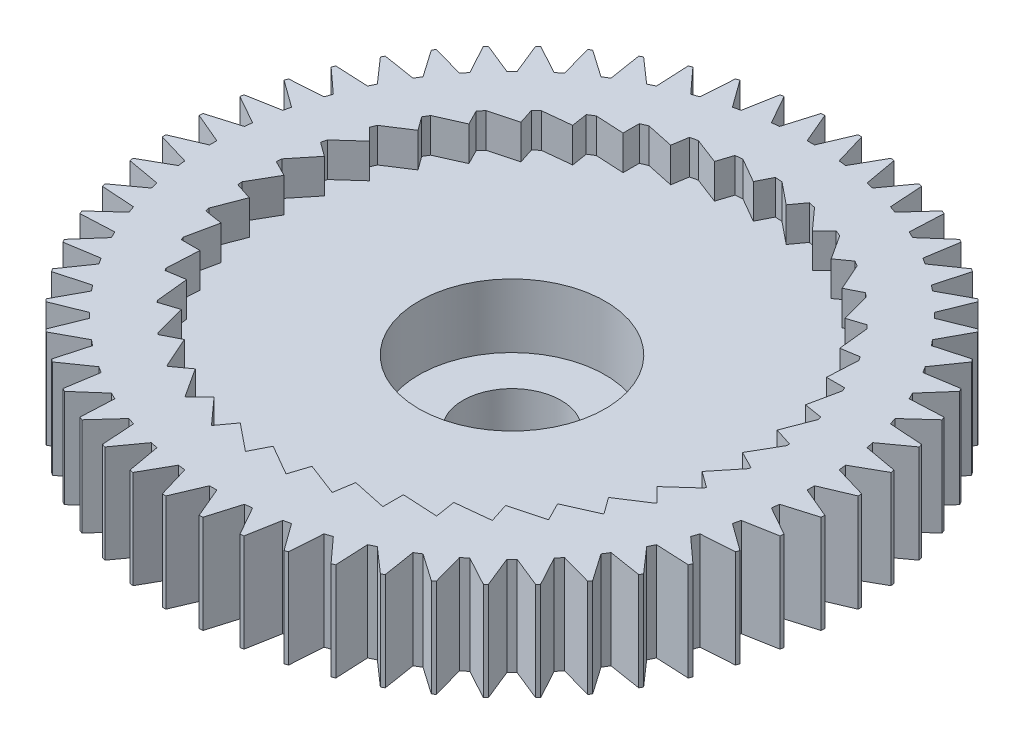
from build123d import *

# Parameters (mm, degrees)
BOSS_EXTRUDE1_DEPTH = 2
CUT_EXTRUDE1_DEPTH  = 0.7
SKETCH3_R           = 2.4
BOSS_EXTRUDE2_DEPTH = 0.75
SKETCH4_R           = 1.75
BOSS_EXTRUDE3_DEPTH = 1
SKETCH5_R           = 1.9
CUT_EXTRUDE2_DEPTH  = 1.3
SKETCH6_R           = 1
CUT_EXTRUDE3_DEPTH  = 2


# Read off the part's stored shape, not the designer's step: Boss-Extrude1
with BuildPart() as part:
    # Boss-Extrude1 outline → Boss-Extrude1 (new body)
    with BuildSketch(Plane(origin=(0, 0, 0), x_dir=(1, 0, 0), z_dir=(0, 1, 0))):
        with BuildLine():
            Line((0.340379237, 6.716380497), (0.075, 6.091186192))
            Line((0.075, 6.091186192), (-0.075, 6.091186192))
            Line((-0.075, 6.091186192), (-0.340379237, 6.716380497))
            ThreePointArc((-0.340379237, 6.716380497), (-0.377073757, 6.714420331), (-0.413757019, 6.712259689))
            Line((-0.413757019, 6.712259689), (-0.607468055, 6.061283428))
            Line((-0.607468055, 6.061283428), (-0.756524887, 6.044488756))
            Line((-0.756524887, 6.044488756), (-1.090235028, 6.636038923))
            ThreePointArc((-1.090235028, 6.636038923), (-1.126479352, 6.6299826), (-1.162690042, 6.623728321))
            Line((-1.162690042, 6.623728321), (-1.282296847, 5.955156507))
            Line((-1.282296847, 5.955156507), (-1.428536034, 5.921778367))
            Line((-1.428536034, 5.921778367), (-1.82638048, 6.472245309))
            ThreePointArc((-1.82638048, 6.472245309), (-1.861718814, 6.46216899), (-1.897001562, 6.451899726))
            Line((-1.897001562, 6.451899726), (-1.941000012, 5.774140038))
            Line((-1.941000012, 5.774140038), (-2.082582511, 5.724598179))
            Line((-2.082582511, 5.724598179), (-2.539558138, 6.227059455))
            ThreePointArc((-2.539558138, 6.227059455), (-2.573546083, 6.213089856), (-2.607457187, 6.198934749))
            Line((-2.607457187, 6.198934749), (-2.575293976, 5.520510408))
            Line((-2.575293976, 5.520510408), (-2.710439306, 5.455427847))
            Line((-2.710439306, 5.455427847), (-3.220799379, 5.903564716))
            ThreePointArc((-3.220799379, 5.903564716), (-3.253009516, 5.885877512), (-3.285122525, 5.86801457))
            Line((-3.285122525, 5.86801457), (-3.177202123, 5.197457157))
            Line((-3.177202123, 5.197457157), (-3.304210753, 5.117652345))
            Line((-3.304210753, 5.117652345), (-3.8615372, 5.505829225))
            ThreePointArc((-3.8615372, 5.505829225), (-3.891564467, 5.484646844), (-3.921475541, 5.463300704))
            Line((-3.921475541, 5.463300704), (-3.739155111, 4.809042866))
            Line((-3.739155111, 4.809042866), (-3.856429833, 4.715519395))
            Line((-3.856429833, 4.715519395), (-4.453713949, 5.038854737))
            ThreePointArc((-4.453713949, 5.038854737), (-4.481180737, 5.014443559), (-4.508513727, 4.989882661))
            Line((-4.508513727, 4.989882661), (-4.254086053, 4.36015207))
            Line((-4.254086053, 4.36015207), (-4.36015207, 4.254086053))
            Line((-4.36015207, 4.254086053), (-4.989882661, 4.508513727))
            ThreePointArc((-4.989882661, 4.508513727), (-5.014443559, 4.481180737), (-5.038854737, 4.453713949))
            Line((-5.038854737, 4.453713949), (-4.715519395, 3.856429833))
            Line((-4.715519395, 3.856429833), (-4.809042866, 3.739155111))
            Line((-4.809042866, 3.739155111), (-5.463300704, 3.921475541))
            ThreePointArc((-5.463300704, 3.921475541), (-5.484646844, 3.891564467), (-5.505829225, 3.8615372))
            Line((-5.505829225, 3.8615372), (-5.117652345, 3.304210753))
            Line((-5.117652345, 3.304210753), (-5.197457157, 3.177202123))
            Line((-5.197457157, 3.177202123), (-5.86801457, 3.285122525))
            ThreePointArc((-5.86801457, 3.285122525), (-5.885877512, 3.253009516), (-5.903564716, 3.220799379))
            Line((-5.903564716, 3.220799379), (-5.455427847, 2.710439306))
            Line((-5.455427847, 2.710439306), (-5.520510408, 2.575293976))
            Line((-5.520510408, 2.575293976), (-6.198934749, 2.607457187))
            ThreePointArc((-6.198934749, 2.607457187), (-6.213089856, 2.573546083), (-6.227059455, 2.539558138))
            Line((-6.227059455, 2.539558138), (-5.724598179, 2.082582511))
            Line((-5.724598179, 2.082582511), (-5.774140038, 1.941000012))
            Line((-5.774140038, 1.941000012), (-6.451899726, 1.897001562))
            ThreePointArc((-6.451899726, 1.897001562), (-6.46216899, 1.861718814), (-6.472245309, 1.82638048))
            Line((-6.472245309, 1.82638048), (-5.921778367, 1.428536034))
            Line((-5.921778367, 1.428536034), (-5.955156507, 1.282296847))
            Line((-5.955156507, 1.282296847), (-6.623728321, 1.162690042))
            ThreePointArc((-6.623728321, 1.162690042), (-6.6299826, 1.126479352), (-6.636038923, 1.090235028))
            Line((-6.636038923, 1.090235028), (-6.044488756, 0.756524887))
            Line((-6.044488756, 0.756524887), (-6.061283428, 0.607468055))
            Line((-6.061283428, 0.607468055), (-6.712259689, 0.413757019))
            ThreePointArc((-6.712259689, 0.413757019), (-6.714420331, 0.377073757), (-6.716380497, 0.340379237))
            Line((-6.716380497, 0.340379237), (-6.091186192, 0.075))
            Line((-6.091186192, 0.075), (-6.091186192, -0.075))
            Line((-6.091186192, -0.075), (-6.716380497, -0.340379237))
            ThreePointArc((-6.716380497, -0.340379237), (-6.714420331, -0.377073757), (-6.712259689, -0.413757019))
            Line((-6.712259689, -0.413757019), (-6.061283428, -0.607468055))
            Line((-6.061283428, -0.607468055), (-6.044488756, -0.756524887))
            Line((-6.044488756, -0.756524887), (-6.636038923, -1.090235028))
            ThreePointArc((-6.636038923, -1.090235028), (-6.6299826, -1.126479352), (-6.623728321, -1.162690042))
            Line((-6.623728321, -1.162690042), (-5.955156507, -1.282296847))
            Line((-5.955156507, -1.282296847), (-5.921778367, -1.428536034))
            Line((-5.921778367, -1.428536034), (-6.472245309, -1.82638048))
            ThreePointArc((-6.472245309, -1.82638048), (-6.46216899, -1.861718814), (-6.451899726, -1.897001562))
            Line((-6.451899726, -1.897001562), (-5.774140038, -1.941000012))
            Line((-5.774140038, -1.941000012), (-5.724598179, -2.082582511))
            Line((-5.724598179, -2.082582511), (-6.227059455, -2.539558138))
            ThreePointArc((-6.227059455, -2.539558138), (-6.213089856, -2.573546083), (-6.198934749, -2.607457187))
            Line((-6.198934749, -2.607457187), (-5.520510408, -2.575293976))
            Line((-5.520510408, -2.575293976), (-5.455427847, -2.710439306))
            Line((-5.455427847, -2.710439306), (-5.903564716, -3.220799379))
            ThreePointArc((-5.903564716, -3.220799379), (-5.885877512, -3.253009516), (-5.86801457, -3.285122525))
            Line((-5.86801457, -3.285122525), (-5.197457157, -3.177202123))
            Line((-5.197457157, -3.177202123), (-5.117652345, -3.304210753))
            Line((-5.117652345, -3.304210753), (-5.505829225, -3.8615372))
            ThreePointArc((-5.505829225, -3.8615372), (-5.484646844, -3.891564467), (-5.463300704, -3.921475541))
            Line((-5.463300704, -3.921475541), (-4.809042866, -3.739155111))
            Line((-4.809042866, -3.739155111), (-4.715519395, -3.856429833))
            Line((-4.715519395, -3.856429833), (-5.038854737, -4.453713949))
            ThreePointArc((-5.038854737, -4.453713949), (-5.014443559, -4.481180737), (-4.989882661, -4.508513727))
            Line((-4.989882661, -4.508513727), (-4.36015207, -4.254086053))
            Line((-4.36015207, -4.254086053), (-4.254086053, -4.36015207))
            Line((-4.254086053, -4.36015207), (-4.508513727, -4.989882661))
            ThreePointArc((-4.508513727, -4.989882661), (-4.481180737, -5.014443559), (-4.453713949, -5.038854737))
            Line((-4.453713949, -5.038854737), (-3.856429833, -4.715519395))
            Line((-3.856429833, -4.715519395), (-3.739155111, -4.809042866))
            Line((-3.739155111, -4.809042866), (-3.921475541, -5.463300704))
            ThreePointArc((-3.921475541, -5.463300704), (-3.891564467, -5.484646844), (-3.8615372, -5.505829225))
            Line((-3.8615372, -5.505829225), (-3.304210753, -5.117652345))
            Line((-3.304210753, -5.117652345), (-3.177202123, -5.197457157))
            Line((-3.177202123, -5.197457157), (-3.285122525, -5.86801457))
            ThreePointArc((-3.285122525, -5.86801457), (-3.253009516, -5.885877512), (-3.220799379, -5.903564716))
            Line((-3.220799379, -5.903564716), (-2.710439306, -5.455427847))
            Line((-2.710439306, -5.455427847), (-2.575293976, -5.520510408))
            Line((-2.575293976, -5.520510408), (-2.607457187, -6.198934749))
            ThreePointArc((-2.607457187, -6.198934749), (-2.573546083, -6.213089856), (-2.539558138, -6.227059455))
            Line((-2.539558138, -6.227059455), (-2.082582511, -5.724598179))
            Line((-2.082582511, -5.724598179), (-1.941000012, -5.774140038))
            Line((-1.941000012, -5.774140038), (-1.897001562, -6.451899726))
            ThreePointArc((-1.897001562, -6.451899726), (-1.861718814, -6.46216899), (-1.82638048, -6.472245309))
            Line((-1.82638048, -6.472245309), (-1.428536034, -5.921778367))
            Line((-1.428536034, -5.921778367), (-1.282296847, -5.955156507))
            Line((-1.282296847, -5.955156507), (-1.162690042, -6.623728321))
            ThreePointArc((-1.162690042, -6.623728321), (-1.126479352, -6.6299826), (-1.090235028, -6.636038923))
            Line((-1.090235028, -6.636038923), (-0.756524887, -6.044488756))
            Line((-0.756524887, -6.044488756), (-0.607468055, -6.061283428))
            Line((-0.607468055, -6.061283428), (-0.413757019, -6.712259689))
            ThreePointArc((-0.413757019, -6.712259689), (-0.377073757, -6.714420331), (-0.340379237, -6.716380497))
            Line((-0.340379237, -6.716380497), (-0.075, -6.091186192))
            Line((-0.075, -6.091186192), (0.075, -6.091186192))
            Line((0.075, -6.091186192), (0.340379237, -6.716380497))
            ThreePointArc((0.340379237, -6.716380497), (0.377073757, -6.714420331), (0.413757019, -6.712259689))
            Line((0.413757019, -6.712259689), (0.607468055, -6.061283428))
            Line((0.607468055, -6.061283428), (0.756524887, -6.044488756))
            Line((0.756524887, -6.044488756), (1.090235028, -6.636038923))
            ThreePointArc((1.090235028, -6.636038923), (1.126479352, -6.6299826), (1.162690042, -6.623728321))
            Line((1.162690042, -6.623728321), (1.282296847, -5.955156507))
            Line((1.282296847, -5.955156507), (1.428536034, -5.921778367))
            Line((1.428536034, -5.921778367), (1.82638048, -6.472245309))
            ThreePointArc((1.82638048, -6.472245309), (1.861718814, -6.46216899), (1.897001562, -6.451899726))
            Line((1.897001562, -6.451899726), (1.941000012, -5.774140038))
            Line((1.941000012, -5.774140038), (2.082582511, -5.724598179))
            Line((2.082582511, -5.724598179), (2.539558138, -6.227059455))
            ThreePointArc((2.539558138, -6.227059455), (2.573546083, -6.213089856), (2.607457187, -6.198934749))
            Line((2.607457187, -6.198934749), (2.575293976, -5.520510408))
            Line((2.575293976, -5.520510408), (2.710439306, -5.455427847))
            Line((2.710439306, -5.455427847), (3.220799379, -5.903564716))
            ThreePointArc((3.220799379, -5.903564716), (3.253009516, -5.885877512), (3.285122525, -5.86801457))
            Line((3.285122525, -5.86801457), (3.177202123, -5.197457157))
            Line((3.177202123, -5.197457157), (3.304210753, -5.117652345))
            Line((3.304210753, -5.117652345), (3.8615372, -5.505829225))
            ThreePointArc((3.8615372, -5.505829225), (3.891564467, -5.484646844), (3.921475541, -5.463300704))
            Line((3.921475541, -5.463300704), (3.739155111, -4.809042866))
            Line((3.739155111, -4.809042866), (3.856429833, -4.715519395))
            Line((3.856429833, -4.715519395), (4.453713949, -5.038854737))
            ThreePointArc((4.453713949, -5.038854737), (4.481180737, -5.014443559), (4.508513727, -4.989882661))
            Line((4.508513727, -4.989882661), (4.254086053, -4.36015207))
            Line((4.254086053, -4.36015207), (4.36015207, -4.254086053))
            Line((4.36015207, -4.254086053), (4.989882661, -4.508513727))
            ThreePointArc((4.989882661, -4.508513727), (5.014443559, -4.481180737), (5.038854737, -4.453713949))
            Line((5.038854737, -4.453713949), (4.715519395, -3.856429833))
            Line((4.715519395, -3.856429833), (4.809042866, -3.739155111))
            Line((4.809042866, -3.739155111), (5.463300704, -3.921475541))
            ThreePointArc((5.463300704, -3.921475541), (5.484646844, -3.891564467), (5.505829225, -3.8615372))
            Line((5.505829225, -3.8615372), (5.117652345, -3.304210753))
            Line((5.117652345, -3.304210753), (5.197457157, -3.177202123))
            Line((5.197457157, -3.177202123), (5.86801457, -3.285122525))
            ThreePointArc((5.86801457, -3.285122525), (5.885877512, -3.253009516), (5.903564716, -3.220799379))
            Line((5.903564716, -3.220799379), (5.455427847, -2.710439306))
            Line((5.455427847, -2.710439306), (5.520510408, -2.575293976))
            Line((5.520510408, -2.575293976), (6.198934749, -2.607457187))
            ThreePointArc((6.198934749, -2.607457187), (6.213089856, -2.573546083), (6.227059455, -2.539558138))
            Line((6.227059455, -2.539558138), (5.724598179, -2.082582511))
            Line((5.724598179, -2.082582511), (5.774140038, -1.941000012))
            Line((5.774140038, -1.941000012), (6.451899726, -1.897001562))
            ThreePointArc((6.451899726, -1.897001562), (6.46216899, -1.861718814), (6.472245309, -1.82638048))
            Line((6.472245309, -1.82638048), (5.921778367, -1.428536034))
            Line((5.921778367, -1.428536034), (5.955156507, -1.282296847))
            Line((5.955156507, -1.282296847), (6.623728321, -1.162690042))
            ThreePointArc((6.623728321, -1.162690042), (6.6299826, -1.126479352), (6.636038923, -1.090235028))
            Line((6.636038923, -1.090235028), (6.044488756, -0.756524887))
            Line((6.044488756, -0.756524887), (6.061283428, -0.607468055))
            Line((6.061283428, -0.607468055), (6.712259689, -0.413757019))
            ThreePointArc((6.712259689, -0.413757019), (6.714420331, -0.377073757), (6.716380497, -0.340379237))
            Line((6.716380497, -0.340379237), (6.091186192, -0.075))
            Line((6.091186192, -0.075), (6.091186192, 0.075))
            Line((6.091186192, 0.075), (6.716380497, 0.340379237))
            ThreePointArc((6.716380497, 0.340379237), (6.714420331, 0.377073757), (6.712259689, 0.413757019))
            Line((6.712259689, 0.413757019), (6.061283428, 0.607468055))
            Line((6.061283428, 0.607468055), (6.044488756, 0.756524887))
            Line((6.044488756, 0.756524887), (6.636038923, 1.090235028))
            ThreePointArc((6.636038923, 1.090235028), (6.6299826, 1.126479352), (6.623728321, 1.162690042))
            Line((6.623728321, 1.162690042), (5.955156507, 1.282296847))
            Line((5.955156507, 1.282296847), (5.921778367, 1.428536034))
            Line((5.921778367, 1.428536034), (6.472245309, 1.82638048))
            ThreePointArc((6.472245309, 1.82638048), (6.46216899, 1.861718814), (6.451899726, 1.897001562))
            Line((6.451899726, 1.897001562), (5.774140038, 1.941000012))
            Line((5.774140038, 1.941000012), (5.724598179, 2.082582511))
            Line((5.724598179, 2.082582511), (6.227059455, 2.539558138))
            ThreePointArc((6.227059455, 2.539558138), (6.213089856, 2.573546083), (6.198934749, 2.607457187))
            Line((6.198934749, 2.607457187), (5.520510408, 2.575293976))
            Line((5.520510408, 2.575293976), (5.455427847, 2.710439306))
            Line((5.455427847, 2.710439306), (5.903564716, 3.220799379))
            ThreePointArc((5.903564716, 3.220799379), (5.885877512, 3.253009516), (5.86801457, 3.285122525))
            Line((5.86801457, 3.285122525), (5.197457157, 3.177202123))
            Line((5.197457157, 3.177202123), (5.117652345, 3.304210753))
            Line((5.117652345, 3.304210753), (5.505829225, 3.8615372))
            ThreePointArc((5.505829225, 3.8615372), (5.484646844, 3.891564467), (5.463300704, 3.921475541))
            Line((5.463300704, 3.921475541), (4.809042866, 3.739155111))
            Line((4.809042866, 3.739155111), (4.715519395, 3.856429833))
            Line((4.715519395, 3.856429833), (5.038854737, 4.453713949))
            ThreePointArc((5.038854737, 4.453713949), (5.014443559, 4.481180737), (4.989882661, 4.508513727))
            Line((4.989882661, 4.508513727), (4.36015207, 4.254086053))
            Line((4.36015207, 4.254086053), (4.254086053, 4.36015207))
            Line((4.254086053, 4.36015207), (4.508513727, 4.989882661))
            ThreePointArc((4.508513727, 4.989882661), (4.481180737, 5.014443559), (4.453713949, 5.038854737))
            Line((4.453713949, 5.038854737), (3.856429833, 4.715519395))
            Line((3.856429833, 4.715519395), (3.739155111, 4.809042866))
            Line((3.739155111, 4.809042866), (3.921475541, 5.463300704))
            ThreePointArc((3.921475541, 5.463300704), (3.891564467, 5.484646844), (3.8615372, 5.505829225))
            Line((3.8615372, 5.505829225), (3.304210753, 5.117652345))
            Line((3.304210753, 5.117652345), (3.177202123, 5.197457157))
            Line((3.177202123, 5.197457157), (3.285122525, 5.86801457))
            ThreePointArc((3.285122525, 5.86801457), (3.253009516, 5.885877512), (3.220799379, 5.903564716))
            Line((3.220799379, 5.903564716), (2.710439306, 5.455427847))
            Line((2.710439306, 5.455427847), (2.575293976, 5.520510408))
            Line((2.575293976, 5.520510408), (2.607457187, 6.198934749))
            ThreePointArc((2.607457187, 6.198934749), (2.573546083, 6.213089856), (2.539558138, 6.227059455))
            Line((2.539558138, 6.227059455), (2.082582511, 5.724598179))
            Line((2.082582511, 5.724598179), (1.941000012, 5.774140038))
            Line((1.941000012, 5.774140038), (1.897001562, 6.451899726))
            ThreePointArc((1.897001562, 6.451899726), (1.861718814, 6.46216899), (1.82638048, 6.472245309))
            Line((1.82638048, 6.472245309), (1.428536034, 5.921778367))
            Line((1.428536034, 5.921778367), (1.282296847, 5.955156507))
            Line((1.282296847, 5.955156507), (1.162690042, 6.623728321))
            ThreePointArc((1.162690042, 6.623728321), (1.126479352, 6.6299826), (1.090235028, 6.636038923))
            Line((1.090235028, 6.636038923), (0.756524887, 6.044488756))
            Line((0.756524887, 6.044488756), (0.607468055, 6.061283428))
            Line((0.607468055, 6.061283428), (0.413757019, 6.712259689))
            ThreePointArc((0.413757019, 6.712259689), (0.377073757, 6.714420331), (0.340379237, 6.716380497))
        make_face()
    extrude(amount=BOSS_EXTRUDE1_DEPTH)

    # Sketch2 → Cut-Extrude1 (cut)
    with BuildSketch(Plane(origin=(0, 2, 0), x_dir=(1, 0, 0), z_dir=(0, 1, 0))):
        with BuildLine():
            Line((1.359605577, -4.544146574), (2.059605577, -4.692936167))
            Line((2.059605577, -4.692936167), (2.059605577, -4.272936167))
            Line((2.059605577, -4.272936167), (2.772534225, -4.310299174))
            ThreePointArc((2.772534225, -4.310299174), (2.773312304, -4.309798588), (2.774090292, -4.309297861))
            Line((2.774090292, -4.309297861), (2.708560761, -3.895560685))
            Line((2.708560761, -3.895560685), (3.415163067, -3.82129379))
            ThreePointArc((3.415163067, -3.82129379), (3.417213017, -3.819460721), (3.419261983, -3.817626552))
            Line((3.419261983, -3.817626552), (3.290491697, -3.421312364))
            Line((3.290491697, -3.421312364), (3.971942884, -3.238718069))
            ThreePointArc((3.971942884, -3.238718069), (3.975370436, -3.234509993), (3.978793531, -3.230298289))
            Line((3.978793531, -3.230298289), (3.791069316, -2.861868772))
            Line((3.791069316, -2.861868772), (4.429656023, -2.577551652))
            ThreePointArc((4.429656023, -2.577551652), (4.434120542, -2.569863813), (4.438571719, -2.562168241))
            Line((4.438571719, -2.562168241), (4.197967735, -2.231005267))
            Line((4.197967735, -2.231005267), (4.777693444, -1.85452699))
            ThreePointArc((4.777693444, -1.85452699), (4.78240129, -1.842352546), (4.787078113, -1.830166152))
            Line((4.787078113, -1.830166152), (4.501167764, -1.544255803))
            Line((4.501167764, -1.544255803), (5.008251971, -1.087675131))
            ThreePointArc((5.008251971, -1.087675131), (5.012002421, -1.070260124), (5.015692314, -1.052832186))
            Line((5.015692314, -1.052832186), (4.693203612, -0.818530429))
            Line((4.693203612, -0.818530429), (5.116452999, -0.295860965))
            ThreePointArc((5.116452999, -0.295860965), (5.117732356, -0.272837915), (5.118908115, -0.249809341))
            Line((5.118908115, -0.249809341), (4.76934672, -0.071698914))
            Line((4.76934672, -0.071698914), (5.100386578, 0.501678939))
            ThreePointArc((5.100386578, 0.501678939), (5.097501413, 0.530192739), (5.094456843, 0.55868996))
            Line((5.094456843, 0.55868996), (4.727722191, 0.677849272))
            Line((4.727722191, 0.677849272), (4.961086803, 1.28578487))
            ThreePointArc((4.961086803, 1.28578487), (4.952323539, 1.319134779), (4.943336089, 1.352424973))
            Line((4.943336089, 1.352424973), (4.56935496, 1.411657765))
            Line((4.56935496, 1.411657765), (4.702445654, 2.037800252))
            ThreePointArc((4.702445654, 2.037800252), (4.686241268, 2.07479343), (4.669745869, 2.111657765))
            Line((4.669745869, 2.111657765), (4.298144553, 2.111657765))
            Line((4.298144553, 2.111657765), (4.331072967, 2.739969334))
            ThreePointArc((4.331072967, 2.739969334), (4.306180563, 2.778926764), (4.280937752, 2.817658064))
            Line((4.280937752, 2.817658064), (3.920769071, 2.760612949))
            Line((3.920769071, 2.760612949), (3.856110083, 3.375802131))
            ThreePointArc((3.856110083, 3.375802131), (3.821743536, 3.41465977), (3.786985442, 3.453167569))
            Line((3.786985442, 3.453167569), (3.44652075, 3.342543885))
            Line((3.44652075, 3.342543885), (3.289004047, 3.930404226))
            ThreePointArc((3.289004047, 3.930404226), (3.244947766, 3.966855051), (3.200487544, 4.002812072))
            Line((3.200487544, 4.002812072), (2.887077159, 3.843121504))
            Line((2.887077159, 3.843121504), (2.643248199, 4.390770315))
            ThreePointArc((2.643248199, 4.390770315), (2.58992109, 4.422435274), (2.536214702, 4.453452592))
            Line((2.536214702, 4.453452592), (2.256213654, 4.250019923))
            Line((2.256213654, 4.250019923), (1.934093707, 4.746041143))
            ThreePointArc((1.934093707, 4.746041143), (1.8725604, 4.77065431), (1.810713963, 4.794469725))
            Line((1.810713963, 4.794469725), (1.569464189, 4.553219952))
            Line((1.569464189, 4.553219952), (1.178235375, 4.987723569))
            ThreePointArc((1.178235375, 4.987723569), (1.110162346, 5.003315357), (1.041883181, 5.017978122))
            Line((1.041883181, 5.017978122), (0.843738816, 4.7452558))
            Line((0.843738816, 4.7452558), (0.393473929, 5.109873117))
            ThreePointArc((0.393473929, 5.109873117), (0.321032992, 5.11493527), (0.248527602, 5.118970505))
            Line((0.248527602, 5.118970505), (0.096907301, 4.821398908))
            Line((0.096907301, 4.821398908), (-0.401643683, 5.109237453))
            ThreePointArc((-0.401643683, 5.109237453), (-0.475917345, 5.102854856), (-0.550090312, 5.09539259))
            Line((-0.550090312, 5.09539259), (-0.652640885, 4.77977438))
            Line((-0.652640885, 4.77977438), (-1.188204626, 4.985358038))
            ThreePointArc((-1.188204626, 4.985358038), (-1.261588537, 4.967294975), (-1.334698115, 4.94815177))
            Line((-1.334698115, 4.94815177), (-1.386449379, 4.621407148))
            Line((-1.386449379, 4.621407148), (-1.947329315, 4.740625859))
            ThreePointArc((-1.947329315, 4.740625859), (-2.017109209, 4.711358131), (-2.086449379, 4.68106334))
            Line((-2.086449379, 4.68106334), (-2.086449379, 4.350196742))
            Line((-2.086449379, 4.350196742), (-2.660586343, 4.380285985))
            ThreePointArc((-2.660586343, 4.380285985), (-2.724254312, 4.340974942), (-2.787341558, 4.300738546))
            Line((-2.787341558, 4.300738546), (-2.735404562, 3.972821259))
            Line((-2.735404562, 3.972821259), (-3.310418339, 3.912384876))
            ThreePointArc((-3.310418339, 3.912384876), (-3.365856155, 3.864794606), (-3.420609899, 3.81641886))
            Line((-3.420609899, 3.81641886), (-3.317335499, 3.498572939))
            Line((-3.317335499, 3.498572939), (-3.88057158, 3.347654286))
            ThreePointArc((-3.88057158, 3.347654286), (-3.926202658, 3.294018471), (-3.971092463, 3.239760739))
            Line((-3.971092463, 3.239760739), (-3.817913118, 2.939129347))
            Line((-3.817913118, 2.939129347), (-4.356519529, 2.699326323))
            ThreePointArc((-4.356519529, 2.699326323), (-4.391415514, 2.642176146), (-4.425561829, 2.584574916))
            Line((-4.425561829, 2.584574916), (-4.224811536, 2.308265842))
            Line((-4.224811536, 2.308265842), (-4.725867932, 1.982876014))
            ThreePointArc((-4.725867932, 1.982876014), (-4.749799883, 1.924844428), (-4.773019262, 1.866524074))
            Line((-4.773019262, 1.866524074), (-4.528011565, 1.621516377))
            Line((-4.528011565, 1.621516377), (-4.978726918, 1.215690451))
            ThreePointArc((-4.978726918, 1.215690451), (-4.992156213, 1.159310719), (-5.004947078, 1.102782727))
            Line((-5.004947078, 1.102782727), (-4.720047414, 0.895791004))
            Line((-4.720047414, 0.895791004), (-5.108034204, 0.41666722))
            ThreePointArc((-5.108034204, 0.41666722), (-5.11204408, 0.364184468), (-5.115514733, 0.311663301))
            Line((-5.115514733, 0.311663301), (-4.796190522, 0.148959489))
            Line((-4.796190522, 0.148959489), (-5.109813223, -0.394250965))
            ThreePointArc((-5.109813223, -0.394250965), (-5.105987753, -0.441037486), (-5.101733905, -0.487787005))
            Line((-5.101733905, -0.487787005), (-4.754565993, -0.600588697))
            Line((-4.754565993, -0.600588697), (-4.983351035, -1.196594109))
            ThreePointArc((-4.983351035, -1.196594109), (-4.973613675, -1.23644329), (-4.963557668, -1.276213256))
            Line((-4.963557668, -1.276213256), (-4.596198762, -1.334397191))
            Line((-4.596198762, -1.334397191), (-4.731283251, -1.969919745))
            ThreePointArc((-4.731283251, -1.969919745), (-4.717711232, -2.002205217), (-4.703918906, -2.034397191))
            Line((-4.703918906, -2.034397191), (-4.324988355, -2.034397191))
            Line((-4.324988355, -2.034397191), (-4.359576888, -2.694385711))
            ThreePointArc((-4.359576888, -2.694385711), (-4.344210194, -2.719092273), (-4.328703485, -2.743711197))
            Line((-4.328703485, -2.743711197), (-3.947612873, -2.683352374))
            Line((-3.947612873, -2.683352374), (-3.877406701, -3.351319483))
            ThreePointArc((-3.877406701, -3.351319483), (-3.862070845, -3.36898112), (-3.846654541, -3.386572581))
            Line((-3.846654541, -3.386572581), (-3.473364552, -3.265283311))
            Line((-3.473364552, -3.265283311), (-3.296925826, -3.9237616))
            ThreePointArc((-3.296925826, -3.9237616), (-3.283086021, -3.935348928), (-3.269205491, -3.94688744))
            Line((-3.269205491, -3.94688744), (-2.91392096, -3.76586093))
            Line((-2.91392096, -3.76586093), (-2.632937026, -4.39696118))
            ThreePointArc((-2.632937026, -4.39696118), (-2.621597833, -4.40373135), (-2.610241233, -4.410472277))
            Line((-2.610241233, -4.410472277), (-2.283057456, -4.172759348))
            Line((-2.283057456, -4.172759348), (-1.902475973, -4.758803439))
            ThreePointArc((-1.902475973, -4.758803439), (-1.894135498, -4.762129326), (-1.885789208, -4.765440595))
            Line((-1.885789208, -4.765440595), (-1.596307991, -4.475959377))
            Line((-1.596307991, -4.475959377), (-1.124322479, -5.000152394))
            ThreePointArc((-1.124322479, -5.000152394), (-1.118984202, -5.001349753), (-1.11364465, -5.002541413))
            Line((-1.11364465, -5.002541413), (-0.870582618, -4.667995226))
            Line((-0.870582618, -4.667995226), (-0.318458922, -5.115096178))
            ThreePointArc((-0.318458922, -5.115096178), (-0.315698108, -5.115267315), (-0.312937203, -5.115436962))
            Line((-0.312937203, -5.115436962), (-0.123751102, -4.744138334))
            Line((-0.123751102, -4.744138334), (0.494502715, -5.101087341))
            ThreePointArc((0.494502715, -5.101087341), (0.495426875, -5.100997668), (0.496351019, -5.100907828))
            Line((0.496351019, -5.100907828), (0.625797084, -4.702513805))
            Line((0.625797084, -4.702513805), (1.293903102, -4.958975677))
            Line((1.293903102, -4.958975677), (1.359605577, -4.544146574))
        make_face()
    extrude(amount=-CUT_EXTRUDE1_DEPTH, mode=Mode.SUBTRACT)

    # Sketch3 → Boss-Extrude2 (add)
    with BuildSketch(Plane(origin=(0, 0, 0), x_dir=(-1, 0, 0), z_dir=(0, -1, 0))):
        with Locations(Location((0, 0, 0), (0, 0, 270))):
            Circle(SKETCH3_R)
    extrude(amount=BOSS_EXTRUDE2_DEPTH)

    # Sketch4 → Boss-Extrude3 (add)
    with BuildSketch(Plane(origin=(0, -0.75, 0), x_dir=(-1, 0, 0), z_dir=(0, -1, 0))):
        with Locations(Location((0, 0, 0), (0, 0, 90))):
            Circle(SKETCH4_R)
    extrude(amount=BOSS_EXTRUDE3_DEPTH)

    # Sketch5 → Cut-Extrude2 (cut)
    with BuildSketch(Plane(origin=(0, 1.3, 0), x_dir=(1, 0, 0), z_dir=(0, 1, 0))):
        with Locations(Location((0, 0, 0), (0, 0, 270))):
            Circle(SKETCH5_R)
    extrude(amount=-CUT_EXTRUDE2_DEPTH, mode=Mode.SUBTRACT)

    # Sketch6 → Cut-Extrude3 (cut)
    with BuildSketch(Plane.XZ.offset(1.75)):
        with Locations(Location((0, 0, 0), (0, 0, 270))):
            Circle(SKETCH6_R)
    extrude(amount=-CUT_EXTRUDE3_DEPTH, mode=Mode.SUBTRACT)


solid = part.part
